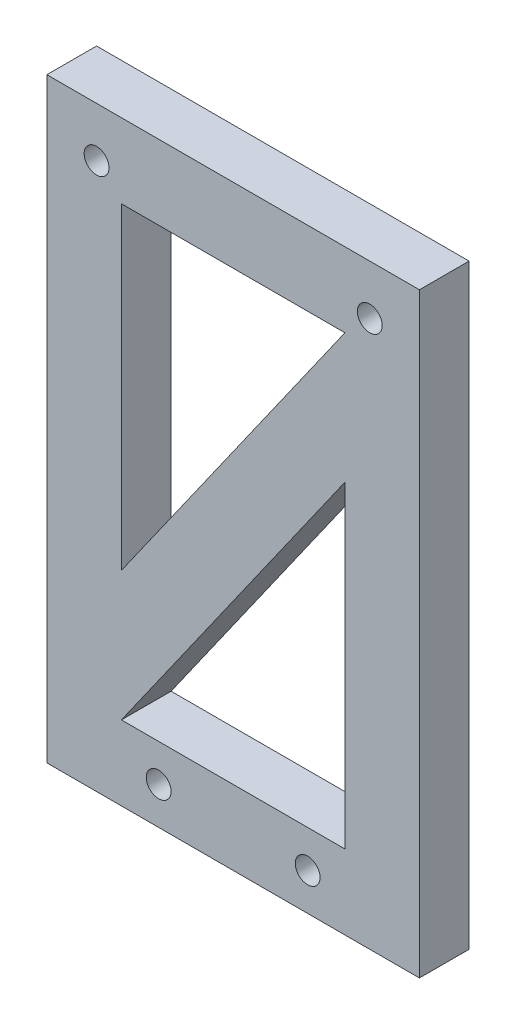
from build123d import *

# Parameters (mm, degrees)
SKETCH1_W          = 75
SKETCH1_H          = 120
BASE_FLANGE1_DEPTH = 10
SKETCH7_R          = 2.5
CUT_EXTRUDE1_DEPTH = 10


# Sheet-metal steps are written as plain solids
with BuildPart() as part:
    # Sketch1 → Base-Flange1 (new body)
    with BuildSketch(Plane.XY):
        with Locations((37.5, 60)):
            Rectangle(SKETCH1_W, SKETCH1_H)
    extrude(amount=-BASE_FLANGE1_DEPTH)

    # Sketch7 → Cut-Extrude1 (cut)
    with BuildSketch(Plane.XY):
        with Locations((10, 110)):
            Circle(SKETCH7_R)
        with Locations((22.5, 7.5)):
            Circle(SKETCH7_R)
        with Locations(Location((52.5, 7.5, 0), (0, 0, 180))):
            Circle(SKETCH7_R)
        with Locations(Location((65, 110, 0), (0, 0, 180))):
            Circle(SKETCH7_R)
        Polygon((15, 105), (15, 41.062028891), (60, 105), align=None)
        Polygon((15, 15), (60, 15), (60, 78.937971109), align=None)
    extrude(amount=-CUT_EXTRUDE1_DEPTH, mode=Mode.SUBTRACT)


solid = part.part
